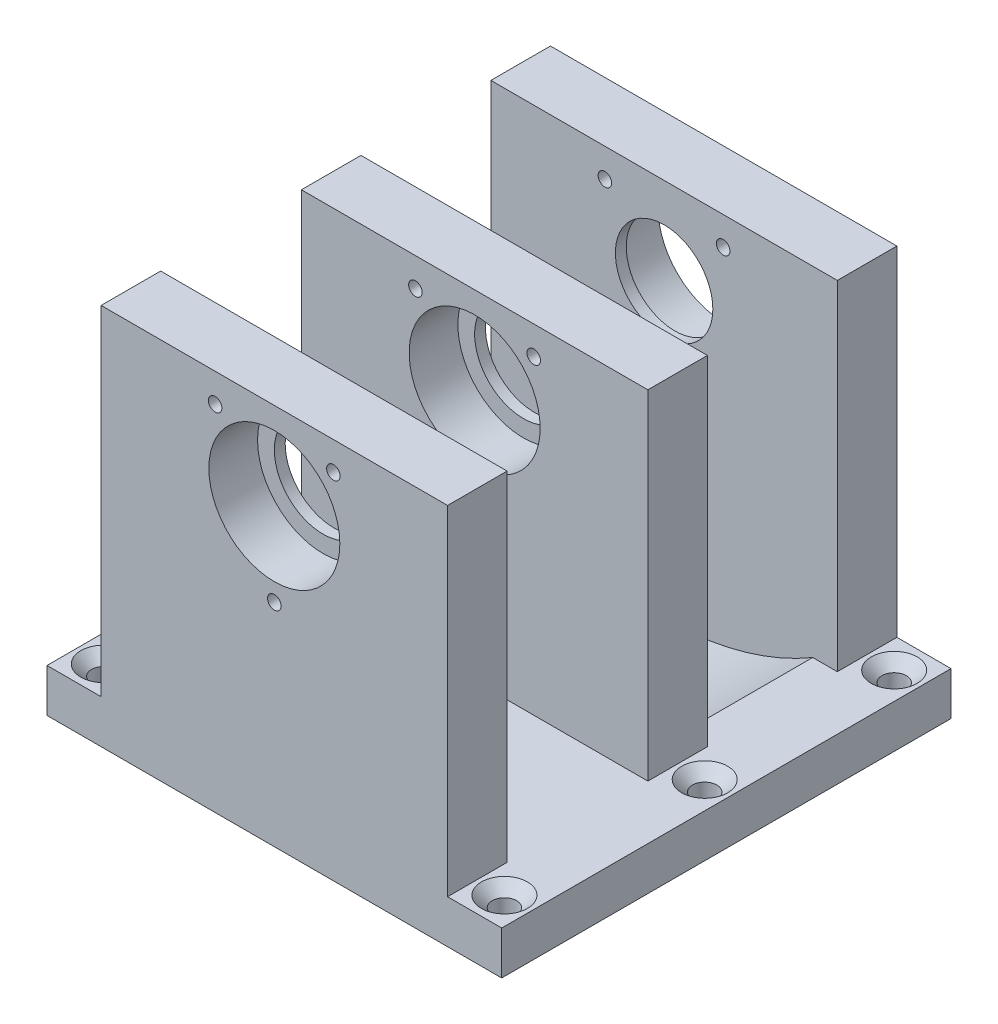
from build123d import *

# Parameters (mm, degrees)
SCHIZZO1_R                    = 12.1
ESTRUSIONE_ESTRUSIONE1_DEPTH  = 11
ESTRUSIONE_ESTRUSIONE2_START  = -2
SCHIZZO2_R                    = 12.1
SCHIZZO2_R_2                  = 9
ESTRUSIONE_ESTRUSIONE2_DEPTH  = 2
SCHIZZO3_R                    = 2.25
TAGLIO_ESTRUSIONE1_DEPTH      = 77.182412669
SMUSSO1_SIZE                  = 2
SCHIZZO4_R                    = 1.25
TAGLIO_ESTRUSIONE2_DEPTH      = 70.679623994
ESTRUSIONE_ESTRUSIONE4_DEPTH  = 24
SCHIZZO7_R                    = 1.25
SCHIZZO7_R_2                  = 9
ESTRUSIONE_ESTRUSIONE5_DEPTH  = 2
SCHIZZO8_R                    = 12.1
SCHIZZO8_R_2                  = 1.25
ESTRUSIONE_ESTRUSIONE6_DEPTH  = 9
SCHIZZO10_W                   = 84
SCHIZZO10_H                   = 8
ESTRUSIONE_ESTRUSIONE8_DEPTH  = 26
SCHIZZO11_R                   = 1.25
SCHIZZO11_R_2                 = 12.1
ESTRUSIONE_ESTRUSIONE9_DEPTH  = 9
SCHIZZO12_R                   = 1.25
SCHIZZO12_R_2                 = 12.1
ESTRUSIONE_ESTRUSIONE10_DEPTH = 2
SCHIZZO13_R                   = 2.25
TAGLIO_ESTRUSIONE3_DEPTH      = 113.123860083
SMUSSO2_SIZE                  = 2
SCHIZZO14_R                   = 12.1
SCHIZZO14_R_2                 = 9
ESTRUSIONE_ESTRUSIONE11_DEPTH = 2


with BuildPart() as part:
    # Schizzo1 → Estrusione-Estrusione1 (new body)
    with BuildSketch(Plane.XY):
        Polygon((-6.171311325, 16.1), (6.171311325, 16.1), (16.171311325, 16.1), (32, 16.1), (32, -46.5), (42, -46.5), (42, -54.5), (17, -54.5), (-17, -54.5), (-42, -54.5), (-42, -46.5), (-32, -46.5), (-32, 16.1), (-16.171311325, 16.1), align=None)
        Circle(SCHIZZO1_R, mode=Mode.SUBTRACT)
    extrude(amount=ESTRUSIONE_ESTRUSIONE1_DEPTH)

    # Schizzo2 → Estrusione-Estrusione2 (add)
    with BuildSketch(Plane.XY.offset(11).offset(ESTRUSIONE_ESTRUSIONE2_START)):
        Circle(SCHIZZO2_R)
        Circle(SCHIZZO2_R_2, mode=Mode.SUBTRACT)
    extrude(amount=ESTRUSIONE_ESTRUSIONE2_DEPTH)

    # Schizzo3 → Taglio-Estrusione1 (cut, through all)
    with BuildSketch(Plane(origin=(0, -46.5, 0), x_dir=(1, 0, 0), z_dir=(0, 1, 0))):
        with Locations((37, -5.5)):
            Circle(SCHIZZO3_R)
        with Locations((-37, -5.5)):
            Circle(SCHIZZO3_R)
    extrude(amount=-TAGLIO_ESTRUSIONE1_DEPTH, mode=Mode.SUBTRACT)

    # Smusso1
    smusso1_edges = [part.edges().sort_by_distance(p)[0] for p in [
        (-39.25, -46.5, 5.5),
        (34.75, -46.5, 5.5),
    ]]
    chamfer(smusso1_edges, length=SMUSSO1_SIZE)

    # Schizzo4 → Taglio-Estrusione2 (cut, through all)
    with BuildSketch(Plane(origin=(0, 0, 0), x_dir=(-1, 0, 0), z_dir=(0, 0, -1))):
        with Locations((-10.910719744, 10.851964601)):
            Circle(SCHIZZO4_R)
        with Locations((10.944459062, 10.817992606)):
            Circle(SCHIZZO4_R)
        with Locations((0, -15.38859776)):
            Circle(SCHIZZO4_R)
    extrude(amount=-TAGLIO_ESTRUSIONE2_DEPTH, mode=Mode.SUBTRACT)

    # Schizzo5 → Estrusione-Estrusione4 (add)
    with BuildSketch(Plane.XY.offset(11)):
        with BuildLine():
            Line((-32, -46.5), (-42, -46.5))
            Line((-42, -46.5), (-42, -54.5))
            Line((-42, -54.5), (42, -54.5))
            Line((42, -54.5), (42, -46.5))
            Line((42, -46.5), (32, -46.5))
            Line((32, -46.5), (27.454507827, -46.5))
            ThreePointArc((27.454507827, -46.5), (0, -54), (-27.454507827, -46.5))
            Line((-27.454507827, -46.5), (-32, -46.5))
        make_face()
    extrude(amount=ESTRUSIONE_ESTRUSIONE4_DEPTH)

    # Schizzo7 → Estrusione-Estrusione5 (add)
    with BuildSketch(Plane.XY.offset(35)):
        Polygon((42, -54.5), (42, -46.5), (32, -46.5), (32, 16.1), (-32, 16.1), (-32, -46.5), (-42, -46.5), (-42, -54.5), align=None)
        with Locations((10.910719744, 10.851964601)):
            Circle(SCHIZZO7_R, mode=Mode.SUBTRACT)
        Circle(SCHIZZO7_R_2, mode=Mode.SUBTRACT)
        with Locations((0, -15.38859776)):
            Circle(SCHIZZO7_R, mode=Mode.SUBTRACT)
        with Locations((-10.944459062, 10.817992606)):
            Circle(SCHIZZO7_R, mode=Mode.SUBTRACT)
    extrude(amount=ESTRUSIONE_ESTRUSIONE5_DEPTH)

    # Schizzo8 → Estrusione-Estrusione6 (add)
    with BuildSketch(Plane.XY.offset(37)):
        Polygon((32, -46.5), (32, 16.1), (-32, 16.1), (-32, -46.5), (-42, -46.5), (-42, -54.5), (42, -54.5), (42, -46.5), align=None)
        Circle(SCHIZZO8_R, mode=Mode.SUBTRACT)
        with Locations((10.910719744, 10.851964601)):
            Circle(SCHIZZO8_R_2, mode=Mode.SUBTRACT)
        with Locations((0, -15.38859776)):
            Circle(SCHIZZO8_R_2, mode=Mode.SUBTRACT)
        with Locations((-10.944459062, 10.817992606)):
            Circle(SCHIZZO8_R_2, mode=Mode.SUBTRACT)
    extrude(amount=ESTRUSIONE_ESTRUSIONE6_DEPTH)

    # Schizzo10 → Estrusione-Estrusione8 (add)
    with BuildSketch(Plane.XY.offset(46)):
        with Locations((0, -50.5)):
            Rectangle(SCHIZZO10_W, SCHIZZO10_H)
    extrude(amount=ESTRUSIONE_ESTRUSIONE8_DEPTH)

    # Schizzo11 → Estrusione-Estrusione9 (add)
    with BuildSketch(Plane.XY.offset(72)):
        Polygon((-32, 16.1), (-32, -46.5), (-42, -46.5), (-42, -54.5), (42, -54.5), (42, -46.5), (32, -46.5), (32, 16.1), align=None)
        with Locations((-10.944459062, 10.817992606)):
            Circle(SCHIZZO11_R, mode=Mode.SUBTRACT)
        with Locations((0, -15.38859776)):
            Circle(SCHIZZO11_R, mode=Mode.SUBTRACT)
        Circle(SCHIZZO11_R_2, mode=Mode.SUBTRACT)
        with Locations((10.910719744, 10.851964601)):
            Circle(SCHIZZO11_R, mode=Mode.SUBTRACT)
    extrude(amount=ESTRUSIONE_ESTRUSIONE9_DEPTH)

    # Schizzo12 → Estrusione-Estrusione10 (add)
    with BuildSketch(Plane.XY.offset(81)):
        Polygon((32, -46.5), (32, 16.1), (-32, 16.1), (-32, -46.5), (-42, -46.5), (-42, -54.5), (42, -54.5), (42, -46.5), align=None)
        with Locations((-10.944459062, 10.817992606)):
            Circle(SCHIZZO12_R, mode=Mode.SUBTRACT)
        with Locations((0, -15.38859776)):
            Circle(SCHIZZO12_R, mode=Mode.SUBTRACT)
        with Locations((10.910719744, 10.851964601)):
            Circle(SCHIZZO12_R, mode=Mode.SUBTRACT)
        Circle(SCHIZZO12_R_2, mode=Mode.SUBTRACT)
    extrude(amount=ESTRUSIONE_ESTRUSIONE10_DEPTH)

    # Schizzo13 → Taglio-Estrusione3 (cut, through all)
    with BuildSketch(Plane(origin=(0, -46.5, 0), x_dir=(1, 0, 0), z_dir=(0, 1, 0))):
        with Locations((37, -40.5)):
            Circle(SCHIZZO13_R)
        with Locations((37, -77.5)):
            Circle(SCHIZZO13_R)
        with Locations((-37, -40.5)):
            Circle(SCHIZZO13_R)
        with Locations((-37, -77.5)):
            Circle(SCHIZZO13_R)
    extrude(amount=-TAGLIO_ESTRUSIONE3_DEPTH, mode=Mode.SUBTRACT)

    # Smusso2
    smusso2_edges = [part.edges().sort_by_distance(p)[0] for p in [
        (-39.25, -46.5, 40.5),
        (-39.25, -46.5, 77.5),
        (34.75, -46.5, 77.5),
        (34.75, -46.5, 40.5),
    ]]
    chamfer(smusso2_edges, length=SMUSSO2_SIZE)

    # Schizzo14 → Estrusione-Estrusione11 (add)
    with BuildSketch(Plane(origin=(0, 0, 72), x_dir=(-1, 0, 0), z_dir=(0, 0, -1))):
        Circle(SCHIZZO14_R)
        Circle(SCHIZZO14_R_2, mode=Mode.SUBTRACT)
    extrude(amount=-ESTRUSIONE_ESTRUSIONE11_DEPTH)


solid = part.part
